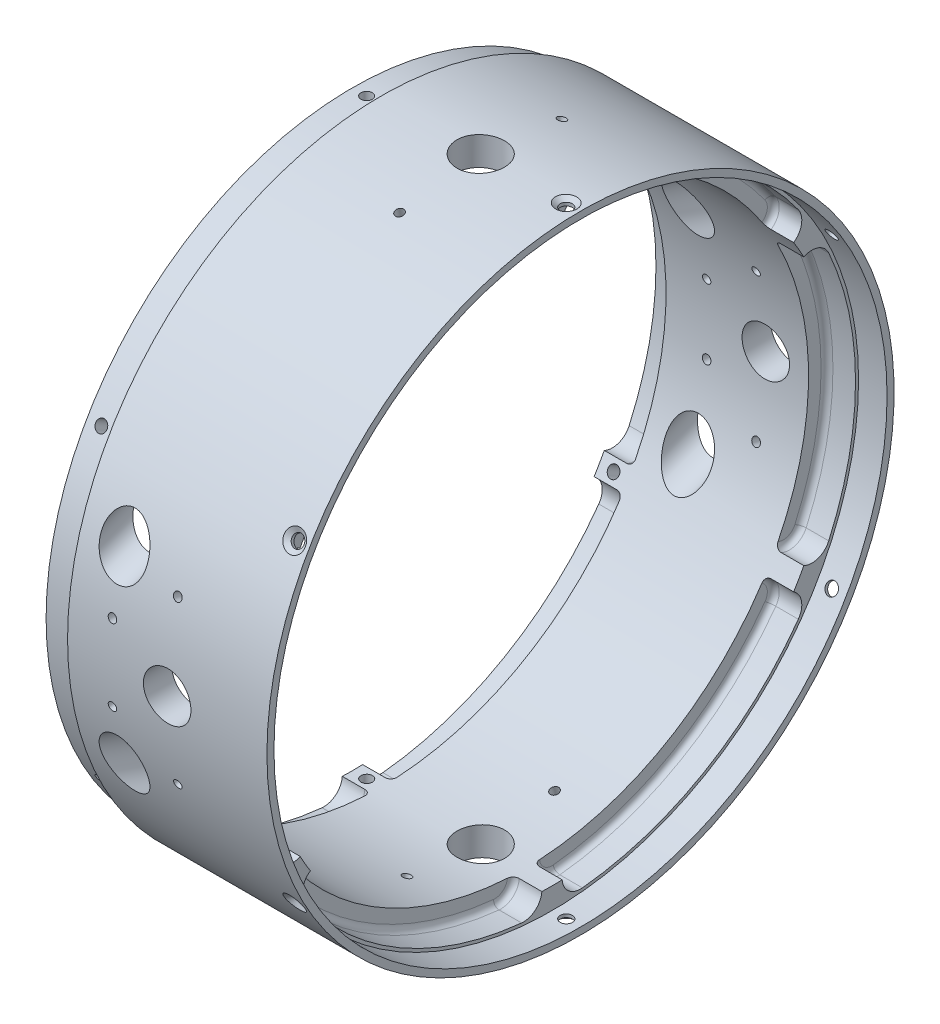
from build123d import *

# Parameters (mm, degrees)
F_31_0_12_DIAMETER_HOLE1_REACH                    = 196.298
F_31_0_12_DIAMETER_HOLE1_BORE_R                   = 1.524
CIRPATTERN4_COUNT                                 = 6
SKETCH8_R                                         = 4.9276
CUT_EXTRUDE1_DEPTH                                = 7.62
CUT_EXTRUDE2_START                                = -7.62
CUT_EXTRUDE2_DEPTH                                = 7.62
FILLET1_R                                         = 1.5875
CIRPATTERN3_COUNT                                 = 6
FILLET1_OF_CIRPATTERN3_R                          = 1.5875
CSK_FOR_4_FLAT_HEAD_MACHINE_SCREW_100_D           = 3.2639
CSK_FOR_4_FLAT_HEAD_MACHINE_SCREW_100_CSINK_D     = 5.715
CSK_FOR_4_FLAT_HEAD_MACHINE_SCREW_100_CSINK_ANGLE = 100
CIRPATTERN5_COUNT                                 = 6
CUT_EXTRUDE6_REACH                                = 190.354
CUT_EXTRUDE6_END_RADIUS                           = 83.82
SKETCH21_R                                        = 6.35
CIRPATTERN6_COUNT                                 = 4
CUT_EXTRUDE7_REACH                                = 195.415
CUT_EXTRUDE7_END_RADIUS                           = 83.82
SKETCH22_R                                        = 6.35
MIRROR2_COPY_1_REACH                              = 195.415
MIRROR2_COPY_1_END_RADIUS                         = 83.82
MIRROR2_COPY_1_SKETCH_R                           = 6.35
F_4_40_TAPPED_HOLE1_D                             = 2.2606
F_4_40_TAPPED_HOLE1_DEPTH                         = 8.8646
F_4_40_TAPPED_HOLE1_TIP                           = 0.679152758
F_4_40_TAPPED_HOLE1_ON_FACE_2_D                   = 2.2606
F_4_40_TAPPED_HOLE1_ON_FACE_2_DEPTH               = 8.8646
F_4_40_TAPPED_HOLE1_ON_FACE_2_TIP                 = 0.679152758
F_4_40_TAPPED_HOLE1_ON_FACE_3_D                   = 2.2606
F_4_40_TAPPED_HOLE1_ON_FACE_3_DEPTH               = 8.8646
F_4_40_TAPPED_HOLE1_ON_FACE_3_TIP                 = 0.679152758
F_4_40_TAPPED_HOLE1_ON_FACE_4_D                   = 2.2606
F_4_40_TAPPED_HOLE1_ON_FACE_4_DEPTH               = 8.8646
F_4_40_TAPPED_HOLE1_ON_FACE_4_TIP                 = 0.679152758
F_4_40_TAPPED_HOLE1_ON_FACE_5_D                   = 2.2606
F_4_40_TAPPED_HOLE1_ON_FACE_5_DEPTH               = 8.8646
F_4_40_TAPPED_HOLE1_ON_FACE_5_TIP                 = 0.679152758
F_4_40_TAPPED_HOLE1_ON_FACE_6_D                   = 2.2606
F_4_40_TAPPED_HOLE1_ON_FACE_6_DEPTH               = 8.8646
F_4_40_TAPPED_HOLE1_ON_FACE_6_TIP                 = 0.679152758
F_4_40_TAPPED_HOLE1_ON_FACE_7_D                   = 2.2606
F_4_40_TAPPED_HOLE1_ON_FACE_7_DEPTH               = 8.8646
F_4_40_TAPPED_HOLE1_ON_FACE_7_TIP                 = 0.679152758
F_4_40_TAPPED_HOLE1_ON_FACE_8_D                   = 2.2606
F_4_40_TAPPED_HOLE1_ON_FACE_8_DEPTH               = 8.8646
F_4_40_TAPPED_HOLE1_ON_FACE_8_TIP                 = 0.679152758
F_4_40_TAPPED_HOLE1_ON_FACE_9_D                   = 2.2606
F_4_40_TAPPED_HOLE1_ON_FACE_9_DEPTH               = 8.8646
F_4_40_TAPPED_HOLE1_ON_FACE_9_TIP                 = 0.679152758
F_4_40_TAPPED_HOLE2_D                             = 2.2606
F_4_40_TAPPED_HOLE2_DEPTH                         = 8.8646
F_4_40_TAPPED_HOLE2_TIP                           = 0.679152758
F_4_40_TAPPED_HOLE2_ON_FACE_2_D                   = 2.2606
F_4_40_TAPPED_HOLE2_ON_FACE_2_DEPTH               = 8.8646
F_4_40_TAPPED_HOLE2_ON_FACE_2_TIP                 = 0.679152758
F_4_40_TAPPED_HOLE2_ON_FACE_3_D                   = 2.2606
F_4_40_TAPPED_HOLE2_ON_FACE_3_DEPTH               = 8.8646
F_4_40_TAPPED_HOLE2_ON_FACE_3_TIP                 = 0.679152758
F_4_40_TAPPED_HOLE2_ON_FACE_4_D                   = 2.2606
F_4_40_TAPPED_HOLE2_ON_FACE_4_DEPTH               = 8.8646
F_4_40_TAPPED_HOLE2_ON_FACE_4_TIP                 = 0.679152758


with BuildPart() as part:
    # Sketch1 → Revolve2 (revolve)
    with BuildSketch(Plane.XY, mode=Mode.PRIVATE) as revolve2_sk:
        Polygon((-0.762, 7.62), (7.62, 7.62), (7.62, 5.7404), (0, 5.7404), (0, 0), (-53.34, 0), (-53.34, 5.6896), (-45.6692, 5.6896), (-45.6692, 7.62), align=None)
    revolve(revolve2_sk.sketch.rotate(Axis((-51.956158524, -76.2, 0), (1, 0, 0)), 90), axis=Axis((-51.956158524, -76.2, 0), (1, 0, 0)))

    # #31 (0.12) Diameter Hole1 bore (on position points) → #31 (0.12) Diameter Hole1 (cut, up to next)
    with BuildSketch(Plane(origin=(-49.53, -158.0896, 0), x_dir=(0, 0, -1), z_dir=(0, -1, 0)), mode=Mode.PRIVATE) as f_31_0_12_diameter_hole1_sk1:
        Circle(F_31_0_12_DIAMETER_HOLE1_BORE_R)
    f_31_0_12_diameter_hole1_tool1 = extrude(f_31_0_12_diameter_hole1_sk1.sketch, amount=-F_31_0_12_DIAMETER_HOLE1_REACH, mode=Mode.PRIVATE) & part.part
    f_31_0_12_diameter_hole1 = f_31_0_12_diameter_hole1_tool1.solids().sort_by_distance((-49.53, -158.0896, 0))[0]
    add(f_31_0_12_diameter_hole1, mode=Mode.SUBTRACT)

    # CirPattern4: #31 (0.12) Diameter Hole1 ×6 about axis
    cirpattern4_axis = Axis((0, -76.2, 0), (1, 0, 0))
    for i in range(1, CIRPATTERN4_COUNT):
        add(f_31_0_12_diameter_hole1.rotate(cirpattern4_axis, i * 360 / CIRPATTERN4_COUNT), mode=Mode.SUBTRACT)

    # Sketch8 → Cut-Extrude1 (cut)
    with BuildSketch(Plane.ZY.offset(53.34)):
        with BuildLine():
            ThreePointArc((-58.835189437, -124.623759497), (-62.55527171, -125.595518929), (-65.841049379, -123.598773174))
            ThreePointArc((-65.841049379, -123.598773174), (-40.5638, -146.458562548), (-8.128016987, -156.919407961))
            ThreePointArc((-8.128016987, -156.919407961), (-11.500138371, -155.072213906), (-12.518611153, -151.364648438))
            ThreePointArc((-12.518611153, -151.364648438), (-38.1, -142.191135768), (-58.835189437, -124.623759497))
        make_face()
        with Locations((-7.634330295, -152.016601091)):
            Circle(SKETCH8_R)
        with Locations((-61.841937426, -120.719824522)):
            Circle(SKETCH8_R)
    cut_extrude1 = extrude(amount=-CUT_EXTRUDE1_DEPTH, mode=Mode.SUBTRACT)

    # Sketch13 → Cut-Extrude2 (cut)
    with BuildSketch(Plane(origin=(0, 0, 0), x_dir=(0, 0, -1), z_dir=(1, 0, 0)).offset(CUT_EXTRUDE2_START)):
        with BuildLine():
            ThreePointArc((64.590076174, -116.629717533), (38.1, -142.191135768), (2.718124364, -152.351505566))
            ThreePointArc((2.718124364, -152.351505566), (4.455320673, -155.781589747), (8.128016987, -156.919407961))
            ThreePointArc((8.128016987, -156.919407961), (40.5638, -146.458562548), (65.841049379, -123.598773174))
            ThreePointArc((65.841049379, -123.598773174), (66.692018058, -119.849215758), (64.590076174, -116.629717533))
        make_face()
    cut_extrude2 = extrude(amount=CUT_EXTRUDE2_DEPTH, mode=Mode.SUBTRACT)

    # Fillet1
    fillet1_edges = [part.edges().sort_by_distance(p)[0] for p in [
        (-45.72, -146.458562548, -40.5638),
        (-45.72, -119.849215758, -66.692018058),
        (-45.72, -155.781589747, -4.455320673),
        (-7.62, -155.781589747, -4.455320673),
        (-7.62, -119.849215758, -66.692018058),
        (-7.62, -146.458562548, -40.5638),
    ]]
    fillet(fillet1_edges, radius=FILLET1_R)

    # CirPattern3: Cut-Extrude1, Cut-Extrude2 ×6 about axis
    cirpattern3_axis = Axis((0, -76.2, 0), (1, 0, 0))
    add([cut_extrude1.rotate(cirpattern3_axis, i * 360 / CIRPATTERN3_COUNT) for i in range(1, CIRPATTERN3_COUNT)], mode=Mode.SUBTRACT)
    add([cut_extrude2.rotate(cirpattern3_axis, i * 360 / CIRPATTERN3_COUNT) for i in range(1, CIRPATTERN3_COUNT)], mode=Mode.SUBTRACT)

    # Fillet1 of CirPattern3
    fillet1_of_cirpattern3_edges = [part.edges().sort_by_distance(p)[0] for p in [
        (-45.72, -76.2, -81.1276),
        (-45.72, -40.267626011, -71.147338731),
        (-45.72, -112.132373989, -71.147338731),
        (-7.62, -112.132373989, -71.147338731),
        (-7.62, -40.267626011, -71.147338731),
        (-7.62, -76.2, -81.1276),
        (-45.72, -5.941437452, -40.5638),
        (-45.72, 3.381589747, -4.455320673),
        (-45.72, -32.550784242, -66.692018058),
        (-7.62, -32.550784242, -66.692018058),
        (-7.62, 3.381589747, -4.455320673),
        (-7.62, -5.941437452, -40.5638),
        (-45.72, -5.941437452, 40.5638),
        (-45.72, -32.550784242, 66.692018058),
        (-45.72, 3.381589747, 4.455320673),
        (-7.62, 3.381589747, 4.455320673),
        (-7.62, -32.550784242, 66.692018058),
        (-7.62, -5.941437452, 40.5638),
        (-45.72, -76.2, 81.1276),
        (-45.72, -112.132373989, 71.147338731),
        (-45.72, -40.267626011, 71.147338731),
        (-7.62, -40.267626011, 71.147338731),
        (-7.62, -112.132373989, 71.147338731),
        (-7.62, -76.2, 81.1276),
        (-45.72, -146.458562548, 40.5638),
        (-45.72, -155.781589747, 4.455320673),
        (-45.72, -119.849215758, 66.692018058),
        (-7.62, -119.849215758, 66.692018058),
        (-7.62, -155.781589747, 4.455320673),
        (-7.62, -146.458562548, 40.5638),
    ]]
    fillet(fillet1_of_cirpattern3_edges, radius=FILLET1_OF_CIRPATTERN3_R)

    # CSK for #4 Flat Head Machine Screw (100)1 (through all)
    with Locations(Plane(origin=(3.81, -160.02, 0), x_dir=(0, 0, -1), z_dir=(0, -1, 0))):
        with Locations((0, 0)):
            csk_for_4_flat_head_machine_screw_100 = CounterSinkHole(CSK_FOR_4_FLAT_HEAD_MACHINE_SCREW_100_D / 2, CSK_FOR_4_FLAT_HEAD_MACHINE_SCREW_100_CSINK_D / 2, counter_sink_angle=CSK_FOR_4_FLAT_HEAD_MACHINE_SCREW_100_CSINK_ANGLE)

    # CirPattern5: CSK for #4 Flat Head Machine Screw (100)1 ×6 about axis
    cirpattern5_axis = Axis((0, -76.2, 0), (-1, 0, 0))
    for i in range(1, CIRPATTERN5_COUNT):
        add(csk_for_4_flat_head_machine_screw_100.rotate(cirpattern5_axis, i * 360 / CIRPATTERN5_COUNT), mode=Mode.SUBTRACT)

    # Cut-Extrude6: up to this cylinder (the profile starts inside it)
    cut_extrude6_end = Plane(origin=(-19.05, -76.2, 0), z_dir=(-1, 0, 0)) * Cylinder(CUT_EXTRUDE6_END_RADIUS, 549.348, mode=Mode.PRIVATE)
    # Sketch21 → Cut-Extrude6 (cut, up to the surface)
    with BuildSketch(Plane.XY, mode=Mode.PRIVATE) as cut_extrude6_sk1:
        with Locations((-19.05, -76.2)):
            Circle(SKETCH21_R)
    cut_extrude6_tool1 = extrude(cut_extrude6_sk1.sketch, amount=-CUT_EXTRUDE6_REACH, mode=Mode.PRIVATE) & cut_extrude6_end
    cut_extrude6 = cut_extrude6_tool1.solids().sort_by_distance((-19.05, -76.2, 0))[0]
    add(cut_extrude6, mode=Mode.SUBTRACT)

    # CirPattern6: Cut-Extrude6 ×4 about axis
    cirpattern6_axis = Axis((0, -76.2, 0), (-1, 0, 0))
    for i in range(1, CIRPATTERN6_COUNT):
        add(cut_extrude6.rotate(cirpattern6_axis, i * 360 / CIRPATTERN6_COUNT), mode=Mode.SUBTRACT)

    # Cut-Extrude7: up to this cylinder (the profile starts inside it)
    cut_extrude7_end = Plane(origin=(-34.29, -76.2, 0), z_dir=(-1, 0, 0)) * Cylinder(CUT_EXTRUDE7_END_RADIUS, 559.47, mode=Mode.PRIVATE)
    # Sketch22 → Cut-Extrude7 (cut, up to the surface)
    with BuildSketch(Plane(origin=(0, -8.913706717, 24.490207929), x_dir=(-1, 0, 0), z_dir=(0, 0.34202014332567265, -0.939692620785907)), mode=Mode.PRIVATE) as cut_extrude7_sk1:
        with Locations(Location((34.29, -122.404577704, 0), (0, 0, 270))):
            Circle(SKETCH22_R)
    cut_extrude7_tool1 = extrude(cut_extrude7_sk1.sketch, amount=CUT_EXTRUDE7_REACH, mode=Mode.PRIVATE) & cut_extrude7_end
    cut_extrude7 = cut_extrude7_tool1.solids().sort_by_distance((-34.29, -123.936385, -17.374623))[0]
    add(cut_extrude7, mode=Mode.SUBTRACT)

    # Mirror1: Cut-Extrude7 across plane
    add(cut_extrude7.mirror(Plane.ZX.offset(-76.2)), mode=Mode.SUBTRACT)

    # Mirror2: Cut-Extrude7 across plane
    add(cut_extrude7.mirror(Plane.XY), mode=Mode.SUBTRACT)

    # Mirror2 copy 1: up to this cylinder (the profile starts inside it)
    mirror2_copy_1_end = Plane(origin=(-34.29, -76.2, 0), z_dir=(-1, 0, 0)) * Cylinder(MIRROR2_COPY_1_END_RADIUS, 559.47, mode=Mode.PRIVATE)
    # Mirror2 copy 1 sketch → Mirror2 copy 1 (cut, up to the surface)
    with BuildSketch(Plane(origin=(0, -143.486293283, -24.490207929), x_dir=(-1, 0, 0), z_dir=(0, -0.34202014332567265, 0.939692620785907)), mode=Mode.PRIVATE) as mirror2_copy_1_sk1:
        with Locations(Location((34.29, -122.404577704, 0), (0, 0, 270))):
            Circle(MIRROR2_COPY_1_SKETCH_R)
    mirror2_copy_1_tool1 = extrude(mirror2_copy_1_sk1.sketch, amount=MIRROR2_COPY_1_REACH, mode=Mode.PRIVATE) & mirror2_copy_1_end
    add(mirror2_copy_1_tool1.solids().sort_by_distance((-34.29, -123.936385, -17.374623))[0], mode=Mode.SUBTRACT)

    # #4-40 Tapped Hole1
    with Locations(Plane(origin=(-19.05, -95.922011237, 73.603547963), x_dir=(0, -0.965925826289, -0.258819045103), z_dir=(0, 0.258819045103, -0.965925826289))):
        with Locations((0, 0)):
            Hole(F_4_40_TAPPED_HOLE1_D / 2, depth=F_4_40_TAPPED_HOLE1_DEPTH)
            with Locations((0, 0, -(F_4_40_TAPPED_HOLE1_DEPTH + F_4_40_TAPPED_HOLE1_TIP / 2))):  # 118° drill point
                Cone(0, F_4_40_TAPPED_HOLE1_D / 2, F_4_40_TAPPED_HOLE1_TIP, mode=Mode.SUBTRACT)

    # #4-40 Tapped Hole1 on face 2
    with Locations(Plane(origin=(-19.05, -56.477988763, 73.603547963), x_dir=(0, -0.965925849201, 0.258818959594), z_dir=(0, -0.258818959594, -0.965925849201))):
        with Locations((0, 0)):
            Hole(F_4_40_TAPPED_HOLE1_ON_FACE_2_D / 2, depth=F_4_40_TAPPED_HOLE1_ON_FACE_2_DEPTH)
            with Locations((0, 0, -(F_4_40_TAPPED_HOLE1_ON_FACE_2_DEPTH + F_4_40_TAPPED_HOLE1_ON_FACE_2_TIP / 2))):  # 118° drill point
                Cone(0, F_4_40_TAPPED_HOLE1_ON_FACE_2_D / 2, F_4_40_TAPPED_HOLE1_ON_FACE_2_TIP, mode=Mode.SUBTRACT)

    # #4-40 Tapped Hole1 on face 3
    with Locations(Plane(origin=(-19.05, -2.596452037, 19.722011237), x_dir=(0, 0.258818959594, -0.965925849201), z_dir=(0, -0.965925849201, -0.258818959594))):
        with Locations((0, 0)):
            Hole(F_4_40_TAPPED_HOLE1_ON_FACE_3_D / 2, depth=F_4_40_TAPPED_HOLE1_ON_FACE_3_DEPTH)
            with Locations((0, 0, -(F_4_40_TAPPED_HOLE1_ON_FACE_3_DEPTH + F_4_40_TAPPED_HOLE1_ON_FACE_3_TIP / 2))):  # 118° drill point
                Cone(0, F_4_40_TAPPED_HOLE1_ON_FACE_3_D / 2, F_4_40_TAPPED_HOLE1_ON_FACE_3_TIP, mode=Mode.SUBTRACT)

    # #4-40 Tapped Hole1 on face 4
    with Locations(Plane(origin=(-19.05, -2.596452037, -19.722011237), x_dir=(0, -0.258818959594, -0.965925849201), z_dir=(0, -0.965925849201, 0.258818959594))):
        with Locations((0, 0)):
            Hole(F_4_40_TAPPED_HOLE1_ON_FACE_4_D / 2, depth=F_4_40_TAPPED_HOLE1_ON_FACE_4_DEPTH)
            with Locations((0, 0, -(F_4_40_TAPPED_HOLE1_ON_FACE_4_DEPTH + F_4_40_TAPPED_HOLE1_ON_FACE_4_TIP / 2))):  # 118° drill point
                Cone(0, F_4_40_TAPPED_HOLE1_ON_FACE_4_D / 2, F_4_40_TAPPED_HOLE1_ON_FACE_4_TIP, mode=Mode.SUBTRACT)

    # #4-40 Tapped Hole1 on face 5
    with Locations(Plane(origin=(-19.05, -56.477988763, -73.603547963), x_dir=(0, 0.965925849201, 0.258818959594), z_dir=(0, -0.258818959594, 0.965925849201))):
        with Locations((0, 0)):
            Hole(F_4_40_TAPPED_HOLE1_ON_FACE_5_D / 2, depth=F_4_40_TAPPED_HOLE1_ON_FACE_5_DEPTH)
            with Locations((0, 0, -(F_4_40_TAPPED_HOLE1_ON_FACE_5_DEPTH + F_4_40_TAPPED_HOLE1_ON_FACE_5_TIP / 2))):  # 118° drill point
                Cone(0, F_4_40_TAPPED_HOLE1_ON_FACE_5_D / 2, F_4_40_TAPPED_HOLE1_ON_FACE_5_TIP, mode=Mode.SUBTRACT)

    # #4-40 Tapped Hole1 on face 6
    with Locations(Plane(origin=(-19.05, -95.922011237, -73.603547963), x_dir=(0, 0.965925849201, -0.258818959594), z_dir=(0, 0.258818959594, 0.965925849201))):
        with Locations((0, 0)):
            Hole(F_4_40_TAPPED_HOLE1_ON_FACE_6_D / 2, depth=F_4_40_TAPPED_HOLE1_ON_FACE_6_DEPTH)
            with Locations((0, 0, -(F_4_40_TAPPED_HOLE1_ON_FACE_6_DEPTH + F_4_40_TAPPED_HOLE1_ON_FACE_6_TIP / 2))):  # 118° drill point
                Cone(0, F_4_40_TAPPED_HOLE1_ON_FACE_6_D / 2, F_4_40_TAPPED_HOLE1_ON_FACE_6_TIP, mode=Mode.SUBTRACT)

    # #4-40 Tapped Hole1 on face 7
    with Locations(Plane(origin=(-19.05, -149.803547963, -19.722011237), x_dir=(0, -0.258818959594, 0.965925849201), z_dir=(0, 0.965925849201, 0.258818959594))):
        with Locations((0, 0)):
            Hole(F_4_40_TAPPED_HOLE1_ON_FACE_7_D / 2, depth=F_4_40_TAPPED_HOLE1_ON_FACE_7_DEPTH)
            with Locations((0, 0, -(F_4_40_TAPPED_HOLE1_ON_FACE_7_DEPTH + F_4_40_TAPPED_HOLE1_ON_FACE_7_TIP / 2))):  # 118° drill point
                Cone(0, F_4_40_TAPPED_HOLE1_ON_FACE_7_D / 2, F_4_40_TAPPED_HOLE1_ON_FACE_7_TIP, mode=Mode.SUBTRACT)

    # #4-40 Tapped Hole1 on face 8
    with Locations(Plane(origin=(-19.05, -149.803547963, 19.722011237), x_dir=(0, 0.258818959594, 0.965925849201), z_dir=(0, 0.965925849201, -0.258818959594))):
        with Locations((0, 0)):
            Hole(F_4_40_TAPPED_HOLE1_ON_FACE_8_D / 2, depth=F_4_40_TAPPED_HOLE1_ON_FACE_8_DEPTH)
            with Locations((0, 0, -(F_4_40_TAPPED_HOLE1_ON_FACE_8_DEPTH + F_4_40_TAPPED_HOLE1_ON_FACE_8_TIP / 2))):  # 118° drill point
                Cone(0, F_4_40_TAPPED_HOLE1_ON_FACE_8_D / 2, F_4_40_TAPPED_HOLE1_ON_FACE_8_TIP, mode=Mode.SUBTRACT)

    # #4-40 Tapped Hole1 on face 9
    with Locations(Plane(origin=(-19.05, -76.2, 0), x_dir=(0, -0.965925826289, -0.258819045103), z_dir=(0, 0.258819045103, -0.965925826289))):
        with Locations((0, 0)):
            Hole(F_4_40_TAPPED_HOLE1_ON_FACE_9_D / 2, depth=F_4_40_TAPPED_HOLE1_ON_FACE_9_DEPTH)
            with Locations((0, 0, -(F_4_40_TAPPED_HOLE1_ON_FACE_9_DEPTH + F_4_40_TAPPED_HOLE1_ON_FACE_9_TIP / 2))):  # 118° drill point
                Cone(0, F_4_40_TAPPED_HOLE1_ON_FACE_9_D / 2, F_4_40_TAPPED_HOLE1_ON_FACE_9_TIP, mode=Mode.SUBTRACT)

    # #4-40 Tapped Hole2
    with Locations(Plane(origin=(-34.290089277, -66.913556033, -75.632016755), x_dir=(0, 0.992546151641, 0.121869343405), z_dir=(0, -0.121869343405, 0.992546151641))):
        with Locations((0, 0)):
            Hole(F_4_40_TAPPED_HOLE2_D / 2, depth=F_4_40_TAPPED_HOLE2_DEPTH)
            with Locations((0, 0, -(F_4_40_TAPPED_HOLE2_DEPTH + F_4_40_TAPPED_HOLE2_TIP / 2))):  # 118° drill point
                Cone(0, F_4_40_TAPPED_HOLE2_D / 2, F_4_40_TAPPED_HOLE2_TIP, mode=Mode.SUBTRACT)

    # #4-40 Tapped Hole2 on face 2
    with Locations(Plane(origin=(-34.289910723, -85.486443967, -75.632016755), x_dir=(0, 0.992546190928, -0.121869023443), z_dir=(0, 0.121869023443, 0.992546190928))):
        with Locations((0, 0)):
            Hole(F_4_40_TAPPED_HOLE2_ON_FACE_2_D / 2, depth=F_4_40_TAPPED_HOLE2_ON_FACE_2_DEPTH)
            with Locations((0, 0, -(F_4_40_TAPPED_HOLE2_ON_FACE_2_DEPTH + F_4_40_TAPPED_HOLE2_ON_FACE_2_TIP / 2))):  # 118° drill point
                Cone(0, F_4_40_TAPPED_HOLE2_ON_FACE_2_D / 2, F_4_40_TAPPED_HOLE2_ON_FACE_2_TIP, mode=Mode.SUBTRACT)

    # #4-40 Tapped Hole2 on face 3
    with Locations(Plane(origin=(-34.29, -66.913556033, 75.632016755), x_dir=(0, -0.992546190928, 0.121869023443), z_dir=(0, -0.121869023443, -0.992546190928))):
        with Locations((0, 0)):
            Hole(F_4_40_TAPPED_HOLE2_ON_FACE_3_D / 2, depth=F_4_40_TAPPED_HOLE2_ON_FACE_3_DEPTH)
            with Locations((0, 0, -(F_4_40_TAPPED_HOLE2_ON_FACE_3_DEPTH + F_4_40_TAPPED_HOLE2_ON_FACE_3_TIP / 2))):  # 118° drill point
                Cone(0, F_4_40_TAPPED_HOLE2_ON_FACE_3_D / 2, F_4_40_TAPPED_HOLE2_ON_FACE_3_TIP, mode=Mode.SUBTRACT)

    # #4-40 Tapped Hole2 on face 4
    with Locations(Plane(origin=(-34.29, -85.486443967, 75.632016755), x_dir=(0, -0.992546190928, -0.121869023443), z_dir=(0, 0.121869023443, -0.992546190928))):
        with Locations((0, 0)):
            Hole(F_4_40_TAPPED_HOLE2_ON_FACE_4_D / 2, depth=F_4_40_TAPPED_HOLE2_ON_FACE_4_DEPTH)
            with Locations((0, 0, -(F_4_40_TAPPED_HOLE2_ON_FACE_4_DEPTH + F_4_40_TAPPED_HOLE2_ON_FACE_4_TIP / 2))):  # 118° drill point
                Cone(0, F_4_40_TAPPED_HOLE2_ON_FACE_4_D / 2, F_4_40_TAPPED_HOLE2_ON_FACE_4_TIP, mode=Mode.SUBTRACT)


solid = part.part
